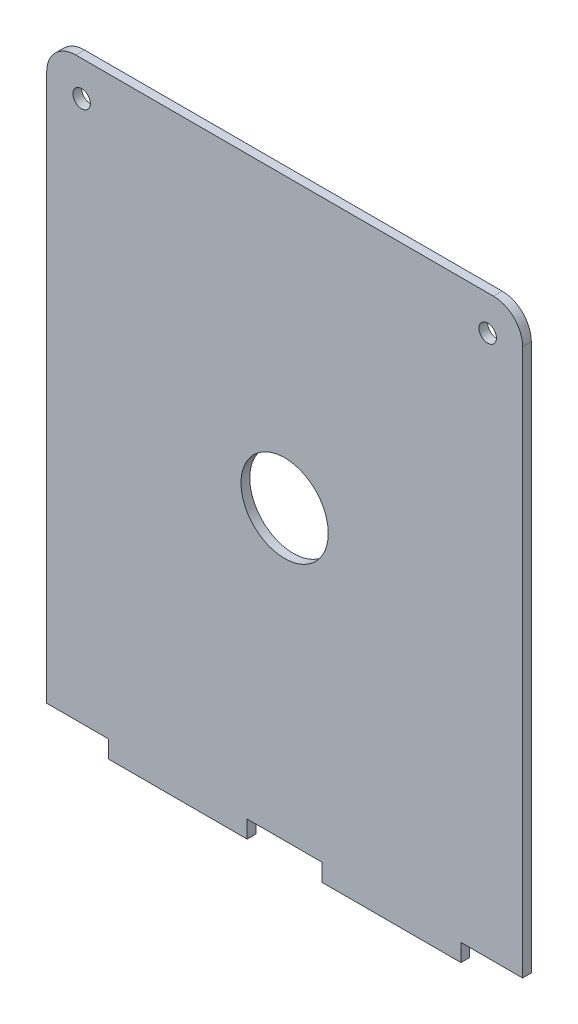
from build123d import *

# Parameters (mm, degrees)
SKETCH1_W           = 81.8
SKETCH1_H           = 102
BOSS_EXTRUDE1_DEPTH = 1.5
SKETCH2_W           = 12.89
SKETCH2_H           = 3
SKETCH2_W_2         = 10.6
SKETCH2_R           = 1.5
CUT_EXTRUDE1_DEPTH  = 131.757370729
FILLET1_R           = 5
SKETCH4_R           = 7.5
CUT_EXTRUDE3_DEPTH  = 10


with BuildPart() as part:
    # Sketch1 → Boss-Extrude1 (new body)
    with BuildSketch(Plane.XY):
        with Locations((40.9, 51)):
            Rectangle(SKETCH1_W, SKETCH1_H)
    extrude(amount=BOSS_EXTRUDE1_DEPTH)

    # Sketch2 → Cut-Extrude1 (cut, through all)
    with BuildSketch(Plane.XY.offset(1.5)):
        with Locations((40.9, 1.5)):
            Rectangle(SKETCH2_W, SKETCH2_H)
        with Locations((76.5, 1.5)):
            Rectangle(SKETCH2_W_2, SKETCH2_H)
        with Locations((5.3, 1.5)):
            Rectangle(SKETCH2_W_2, SKETCH2_H)
        with Locations((6, 96)):
            Circle(SKETCH2_R)
        with Locations((75.8, 96)):
            Circle(SKETCH2_R)
    extrude(amount=-CUT_EXTRUDE1_DEPTH, mode=Mode.SUBTRACT)

    # Fillet1
    fillet1_edges = [part.edges().sort_by_distance(p)[0] for p in [
        (81.8, 102, 0.75),
        (0, 102, 0.75),
    ]]
    fillet(fillet1_edges, radius=FILLET1_R)

    # Sketch4 → Cut-Extrude3 (cut)
    with BuildSketch(Plane.XY.offset(1.5)):
        with Locations((40.9, 52.5)):
            Circle(SKETCH4_R)
    extrude(amount=-CUT_EXTRUDE3_DEPTH, mode=Mode.SUBTRACT)


solid = part.part
